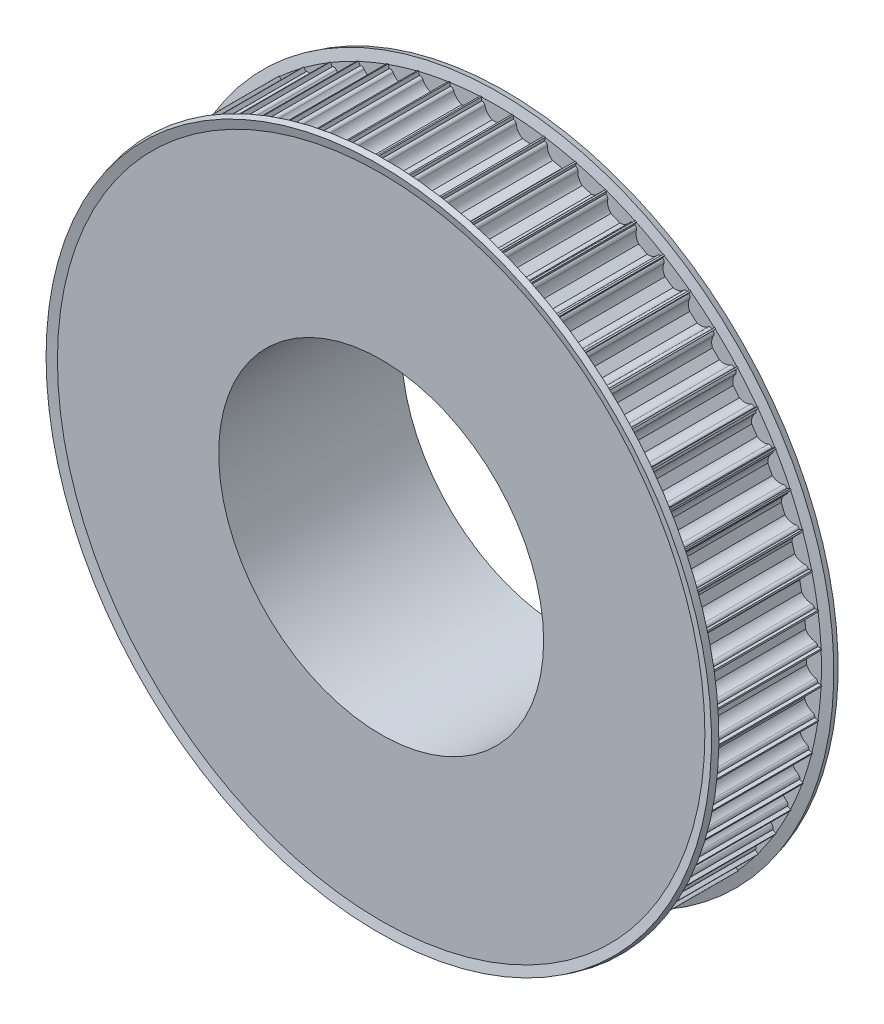
from build123d import *

# Parameters (mm, degrees)
CUT_EXTRUDE1_DEPTH = 35
CIRPATTERN1_COUNT  = 64
SKETCH4_W          = 30
SKETCH4_H          = 2.562641828


with BuildPart() as part:
    # Sketch1 → Revolve1 (revolve)
    with BuildSketch(Plane(origin=(0, 0, 0), x_dir=(0, 0, -1), z_dir=(1, 0, 0))):
        Polygon((0, 40), (45, 40), (45, 55.5), (30, 55.5), (30, 80), (0, 80), align=None)
    revolve(axis=Axis((0, 0, 0), (0, 0, -1)))

    # Sketch2 → Cut-Extrude1 (cut)
    with BuildSketch(Plane.XY):
        with BuildLine():
            Line((3.75, 79), (3.674234614, 79))
            ThreePointArc((3.674234614, 79), (3.199892965, 78.830947502), (2.939387691, 78.4))
            ThreePointArc((2.939387691, 78.4), (2.331759211, 77.112435701), (1.198957881, 76.25))
            Line((1.198957881, 76.25), (-1.198957881, 76.25))
            ThreePointArc((-1.198957881, 76.25), (-2.331759211, 77.112435701), (-2.939387691, 78.4))
            ThreePointArc((-2.939387691, 78.4), (-3.199892965, 78.830947502), (-3.674234614, 79))
            Line((-3.674234614, 79), (-3.75, 79))
            Line((-3.75, 79), (-3.75, 81))
            Line((-3.75, 81), (3.75, 81))
            Line((3.75, 81), (3.75, 79))
        make_face()
    cut_extrude1 = extrude(amount=-CUT_EXTRUDE1_DEPTH, mode=Mode.SUBTRACT)

    # CirPattern1: Cut-Extrude1 ×64 about axis
    cirpattern1_axis = Axis((0, 0, 0), (0, 0, 1))
    for i in range(1, CIRPATTERN1_COUNT):
        add(cut_extrude1.rotate(cirpattern1_axis, i * 360 / CIRPATTERN1_COUNT), mode=Mode.SUBTRACT)

    # Sketch4 → Revolve3 (revolve)
    with BuildSketch(Plane(origin=(0, 0, 0), x_dir=(0, 0, -1), z_dir=(1, 0, 0))):
        Polygon((-0.591966801, 81.906598335), (0, 79.697348156), (0, 74.894826902), (1.5, 74.894826902), (1.5, 79.894826902), (0.856921938, 82.294826902), align=None)
        with Locations((15, -74.596060615)):
            Rectangle(SKETCH4_W, SKETCH4_H)
        Polygon((29.143078062, 82.294826902), (28.5, 79.894826902), (28.5, 74.894826902), (30, 74.894826902), (30, 79.697348156), (30.591966801, 81.906598335), align=None)
    revolve(axis=Axis((0, 0, 0), (0, 0, 1)))


solid = part.part
